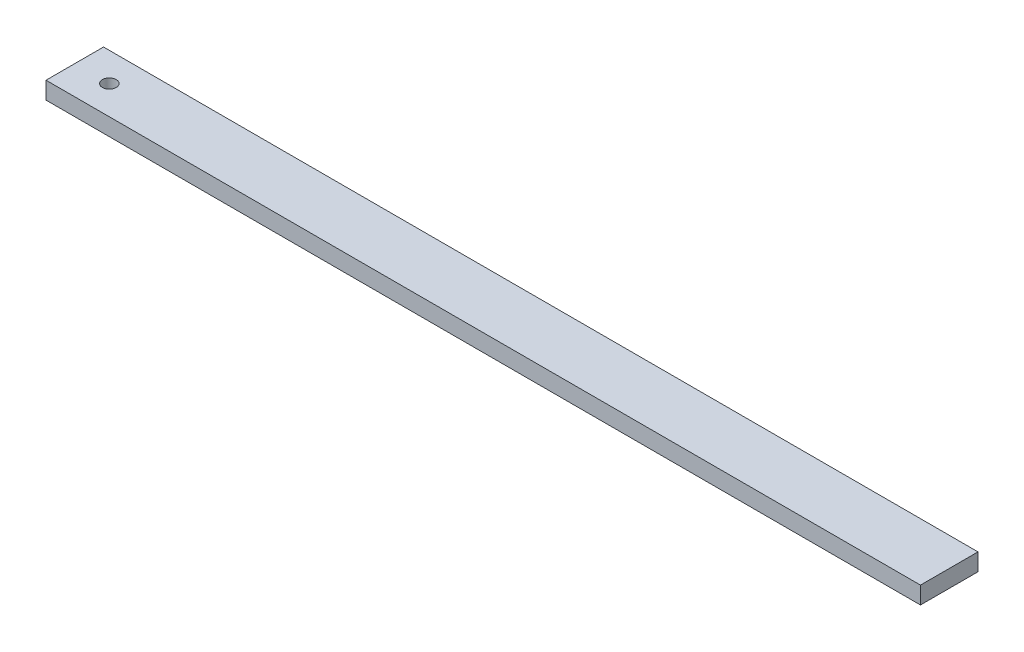
from build123d import *

# Parameters (mm, degrees)
SKETCH1_W           = 241.3
SKETCH1_H           = 15.875
SKETCH1_R           = 1.905
BOSS_EXTRUDE1_DEPTH = 4.7625


with BuildPart() as part:
    # Sketch1 → Boss-Extrude1 (new body)
    with BuildSketch(Plane(origin=(0, 0, 0), x_dir=(1, 0, 0), z_dir=(0, 1, 0))):
        with Locations((111.125, 0)):
            Rectangle(SKETCH1_W, SKETCH1_H)
        Circle(SKETCH1_R, mode=Mode.SUBTRACT)
    extrude(amount=BOSS_EXTRUDE1_DEPTH)


solid = part.part
